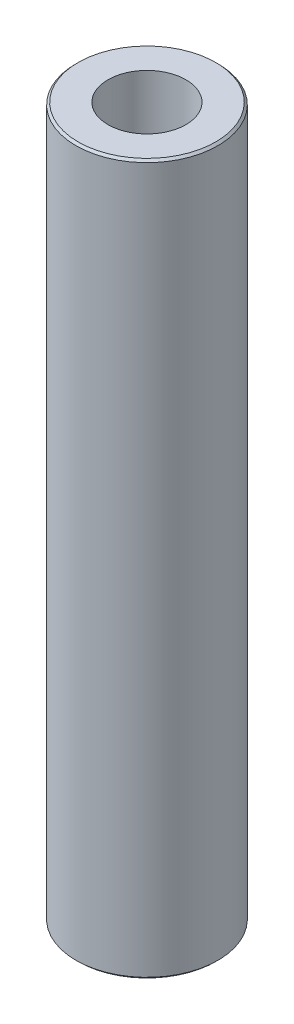
from build123d import *
from OCP.BRepFilletAPI import BRepFilletAPI_MakeChamfer

# Parameters (mm, degrees)
SKETCH1_R           = 60
BOSS_EXTRUDE1_DEPTH = 600
SKETCH2_R           = 32.930304312
CUT_EXTRUDE1_DEPTH  = 606.970296302
CHAMFER1_SIZE       = 1.856345891
CHAMFER1_SIZE2      = 1.828051819


with BuildPart() as part:
    # Sketch1 → Boss-Extrude1 (new body)
    with BuildSketch(Plane(origin=(0, 0, 0), x_dir=(1, 0, 0), z_dir=(0, 1, 0))):
        Circle(SKETCH1_R)
    extrude(amount=BOSS_EXTRUDE1_DEPTH)

    # Sketch2 → Cut-Extrude1 (cut, through all)
    with BuildSketch(Plane(origin=(0, 0, 0), x_dir=(1, 0, 0), z_dir=(0, 1, 0))):
        Circle(SKETCH2_R)
    extrude(amount=CUT_EXTRUDE1_DEPTH, mode=Mode.SUBTRACT)

    # Chamfer1: one chamfer whose edges measure the first distance from different faces: ONE call of the kernel's chamfer builder (chamfer() names one face for all edges)
    chamfer1_edges_1 = [part.edges().sort_by_distance(p)[0] for p in [
        (-60, 600, 0),
    ]]
    chamfer1_side_1 = [part.faces().sort_by_distance(p)[0] for p in [
        (-60, 300, 0),
    ]]
    chamfer1_edges_2 = [part.edges().sort_by_distance(p)[0] for p in [
        (-60, 0, 0),
    ]]
    chamfer1_side_2 = [part.faces().sort_by_distance(p)[0] for p in [
        (-58.302943725, 0, 0),
    ]]
    chamfer1 = BRepFilletAPI_MakeChamfer(part.part.solid().wrapped)
    for e in chamfer1_edges_1:
        chamfer1.Add(CHAMFER1_SIZE, CHAMFER1_SIZE2, e.wrapped, chamfer1_side_1[0].wrapped)  # the first distance lies on this face
    for e in chamfer1_edges_2:
        chamfer1.Add(CHAMFER1_SIZE, CHAMFER1_SIZE2, e.wrapped, chamfer1_side_2[0].wrapped)  # the first distance lies on this face
    add(Compound.cast(chamfer1.Shape()), mode=Mode.REPLACE)


solid = part.part
